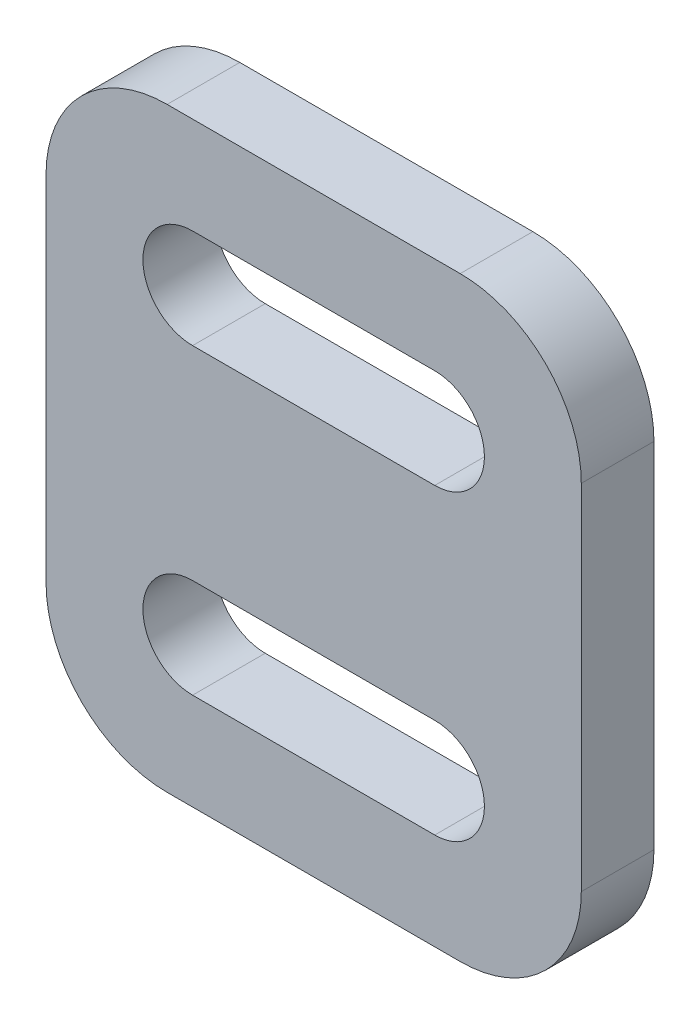
from build123d import *

# Parameters (mm, degrees)
ESBO_O1_W                = 22.1
ESBO_O1_H                = 24.6
RESSALTO_EXTRUS_O1_DEPTH = 3
FILETE1_R                = 5


with BuildPart() as part:
    # Esboço1 → Ressalto-extrusão1 (new body)
    with BuildSketch(Plane.XY):
        with Locations((27.12188209, 20.25)):
            Rectangle(ESBO_O1_W, ESBO_O1_H)
        with BuildLine():
            ThreePointArc((22.12188209, 11.95), (20.07188209, 14), (22.12188209, 16.05))
            Line((22.12188209, 16.05), (32.12188209, 16.05))
            ThreePointArc((32.12188209, 16.05), (34.17188209, 14), (32.12188209, 11.95))
            Line((32.12188209, 11.95), (22.12188209, 11.95))
        make_face(mode=Mode.SUBTRACT)
        with BuildLine():
            ThreePointArc((22.12188209, 24.45), (20.07188209, 26.5), (22.12188209, 28.55))
            Line((22.12188209, 28.55), (32.12188209, 28.55))
            ThreePointArc((32.12188209, 28.55), (34.17188209, 26.5), (32.12188209, 24.45))
            Line((32.12188209, 24.45), (22.12188209, 24.45))
        make_face(mode=Mode.SUBTRACT)
    extrude(amount=RESSALTO_EXTRUS_O1_DEPTH)

    # Filete1
    filete1_edges = [part.edges().sort_by_distance(p)[0] for p in [
        (16.07188209, 32.55, 1.5),
        (16.07188209, 7.95, 1.5),
        (38.17188209, 7.95, 1.5),
        (38.17188209, 32.55, 1.5),
    ]]
    fillet(filete1_edges, radius=FILETE1_R)


solid = part.part
